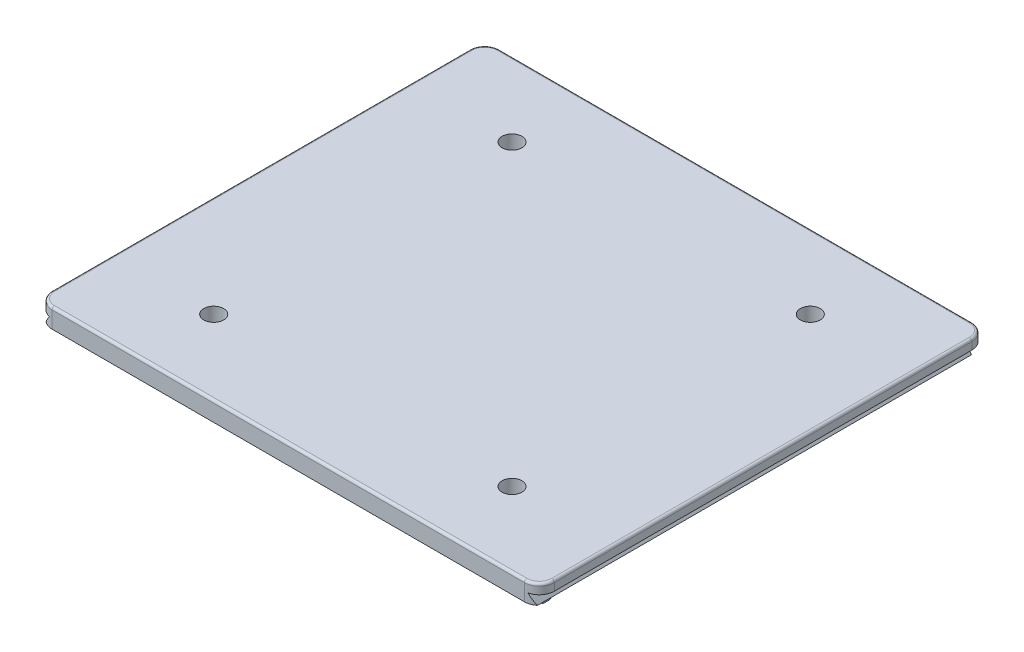
from build123d import *

# Parameters (mm, degrees)
BOSS_EXTRUDE1_DEPTH = 88
SKETCH2_W           = 101
SKETCH2_H           = 2
BOSS_EXTRUDE2_DEPTH = 2
SKETCH3_W           = 98.84033909
SKETCH3_H           = 2
BOSS_EXTRUDE3_DEPTH = 0.25
FILLET2_R           = 0.5
FILLET1_R           = 3
CUT_EXTRUDE1_REACH  = 122.818
SKETCH4_R           = 2
FILLET3_R           = 0.5


with BuildPart() as part:
    # Sketch1 → Boss-Extrude1 (new body)
    with BuildSketch(Plane.XY):
        Polygon((19.420169545, 24.25), (18.194806353, 26), (18.124785599, 26.1), (20.5, 26.1), (20.5, 28.1), (-80.5, 28.1), (-80.5, 26.1), (-78.124785599, 26.1), (-79.420169545, 24.25), align=None)
    extrude(amount=-BOSS_EXTRUDE1_DEPTH)

    # Sketch2 → Boss-Extrude2 (add)
    with BuildSketch(Plane(origin=(0, 0, -88), x_dir=(-1, 0, 0), z_dir=(0, 0, -1))):
        with Locations((30, 27.1)):
            Rectangle(SKETCH2_W, SKETCH2_H)
    extrude(amount=BOSS_EXTRUDE2_DEPTH)

    # Sketch3 → Boss-Extrude3 (add)
    with BuildSketch(Plane.XZ.offset(-24.25)):
        with Locations((-30, -2.5)):
            Rectangle(SKETCH3_W, SKETCH3_H)
    extrude(amount=BOSS_EXTRUDE3_DEPTH)

    # Fillet2
    # the kernel refuses this fillet: 0.5 mm, written as the material it takes off along each edge
    with BuildSketch(Plane(origin=(-80.502701299, 24, -3.5), x_dir=(0, 0, 1), z_dir=(1, 0, 0))) as fillet2_piece_1:
        with BuildLine():
            CenterArc((0.433012702, -0.5), FILLET2_R, 90, 60)
            Line((0, -0.25), (-0.008660254, -0.245))
            ThreePointArc((-0.008660254, -0.245), (-0.01, -0.125), (-0.01, 0))
            Line((-0.01, 0), (0, 0.01))
            Line((0, 0.01), (0.433012702, 0.01))
            Line((0.433012702, 0.01), (0.433012702, 0))
        make_face()
    extrude(amount=101.005402599, mode=Mode.SUBTRACT)
    with BuildSketch(Plane(origin=(20.502701299, 24, -1.5), x_dir=(0, 1, 0), z_dir=(-1, 0, 0))) as fillet2_piece_2:
        with BuildLine():
            CenterArc((0.5, 0.433012702), FILLET2_R, 180, 60)
            Line((0, 0.433012702), (-0.01, 0.433012702))
            Line((-0.01, 0.433012702), (-0.01, 0))
            Line((-0.01, 0), (0, -0.01))
            ThreePointArc((0, -0.01), (0.125, -0.01), (0.245, -0.008660254))
            Line((0.245, -0.008660254), (0.25, 0))
        make_face()
    extrude(amount=101.005402599, mode=Mode.SUBTRACT)

    # Fillet1
    fillet1_edges = [part.edges().sort_by_distance(p)[0] for p in [
        (-80.5, 27.1, -90),
        (20.5, 27.1, -90),
        (20.5, 27.1, 0),
        (-80.5, 27.1, 0),
    ]]
    fillet(fillet1_edges, radius=FILLET1_R)

    # Sketch4 → Cut-Extrude1 (cut, up to next)
    with BuildSketch(Plane(origin=(0, 28.1, 0), x_dir=(1, 0, 0), z_dir=(0, 1, 0)), mode=Mode.PRIVATE) as cut_extrude1_sk1:
        with Locations(Location((0, 75, 0), (0, 0, 180))):
            Circle(SKETCH4_R)
    cut_extrude1_tool1 = extrude(cut_extrude1_sk1.sketch, amount=-CUT_EXTRUDE1_REACH, mode=Mode.PRIVATE) & part.part
    # Sketch4 → Cut-Extrude1 (cut, up to next)
    with BuildSketch(Plane(origin=(0, 28.1, 0), x_dir=(1, 0, 0), z_dir=(0, 1, 0)), mode=Mode.PRIVATE) as cut_extrude1_sk2:
        with Locations(Location((0, 15, 0), (0, 0, 180))):
            Circle(SKETCH4_R)
    cut_extrude1_tool2 = extrude(cut_extrude1_sk2.sketch, amount=-CUT_EXTRUDE1_REACH, mode=Mode.PRIVATE) & part.part
    # Sketch4 → Cut-Extrude1 (cut, up to next)
    with BuildSketch(Plane(origin=(0, 28.1, 0), x_dir=(1, 0, 0), z_dir=(0, 1, 0)), mode=Mode.PRIVATE) as cut_extrude1_sk3:
        with Locations(Location((-60, 15, 0), (0, 0, 180))):
            Circle(SKETCH4_R)
    cut_extrude1_tool3 = extrude(cut_extrude1_sk3.sketch, amount=-CUT_EXTRUDE1_REACH, mode=Mode.PRIVATE) & part.part
    # Sketch4 → Cut-Extrude1 (cut, up to next)
    with BuildSketch(Plane(origin=(0, 28.1, 0), x_dir=(1, 0, 0), z_dir=(0, 1, 0)), mode=Mode.PRIVATE) as cut_extrude1_sk4:
        with Locations(Location((-60, 75, 0), (0, 0, 180))):
            Circle(SKETCH4_R)
    cut_extrude1_tool4 = extrude(cut_extrude1_sk4.sketch, amount=-CUT_EXTRUDE1_REACH, mode=Mode.PRIVATE) & part.part
    add(cut_extrude1_tool1.solids().sort_by_distance((0, 28.1, -75))[0], mode=Mode.SUBTRACT)
    add(cut_extrude1_tool2.solids().sort_by_distance((0, 28.1, -15))[0], mode=Mode.SUBTRACT)
    add(cut_extrude1_tool3.solids().sort_by_distance((-60, 28.1, -15))[0], mode=Mode.SUBTRACT)
    add(cut_extrude1_tool4.solids().sort_by_distance((-60, 28.1, -75))[0], mode=Mode.SUBTRACT)

    # Fillet3
    fillet3_edges = [part.edges().sort_by_distance(p)[0] for p in [
        (-30, 28.1, 0),
        (20.5, 28.1, -45),
        (-30, 28.1, -90),
        (-80.5, 28.1, -45),
        (-79.621320344, 28.1, -89.121320344),
        (19.621320344, 28.1, -89.121320344),
        (-79.621320344, 28.1, -0.878679656),
        (19.621320344, 28.1, -0.878679656),
    ]]
    fillet(fillet3_edges, radius=FILLET3_R)


solid = part.part
